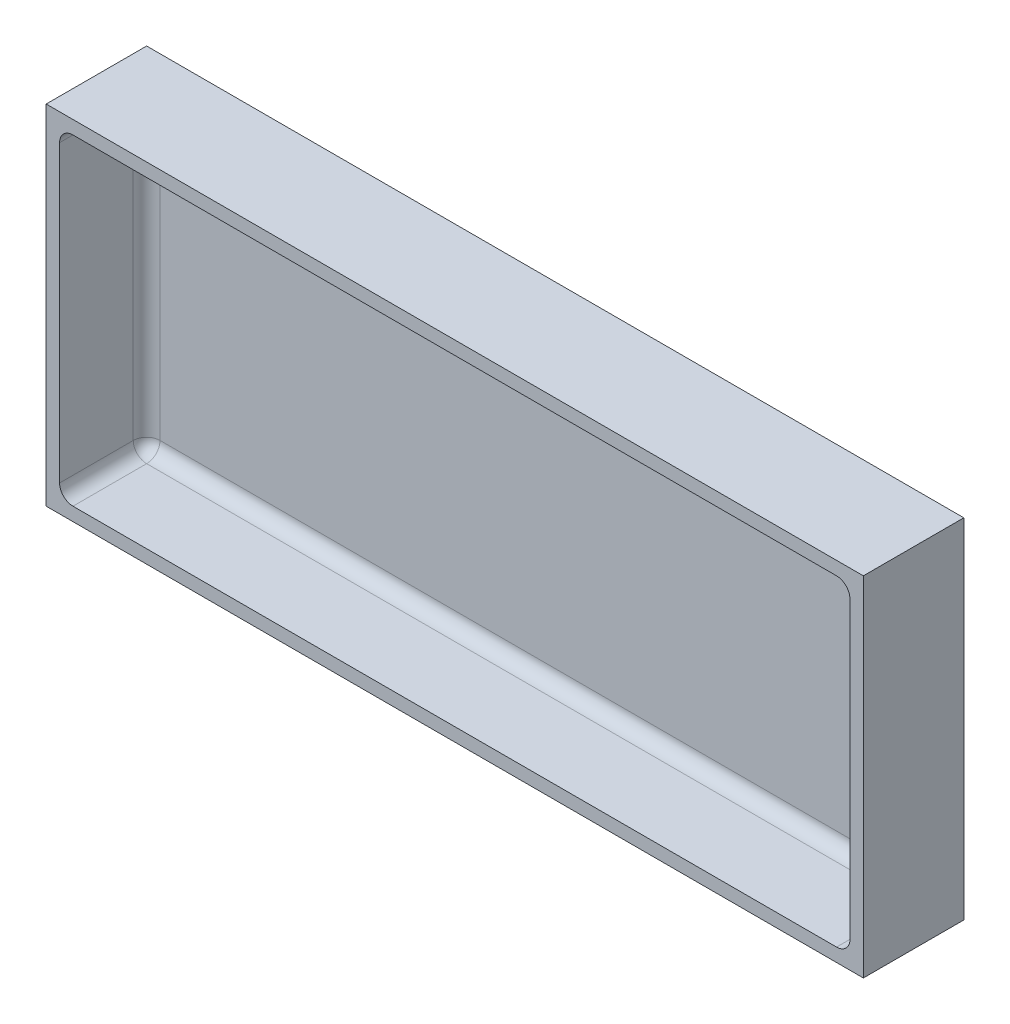
from build123d import *

# Parameters (mm, degrees)
SKETCH1_W           = 122
SKETCH1_H           = 52
BOSS_EXTRUDE1_DEPTH = 15
SHELL1_T            = -2
FILLET1_R           = 2


with BuildPart() as part:
    # Sketch1 → Boss-Extrude1 (new body)
    with BuildSketch(Plane.XY):
        Rectangle(SKETCH1_W, SKETCH1_H)
    extrude(amount=-BOSS_EXTRUDE1_DEPTH)

    # Shell1
    shell1_openings = [part.faces().sort_by_distance(p)[0] for p in [
        (0, 0, 0),
    ]]
    offset(amount=SHELL1_T, openings=shell1_openings, kind=Kind.INTERSECTION)

    # Fillet1
    fillet1_edges = [part.edges().sort_by_distance(p)[0] for p in [
        (-59, 24, -6.5),
        (-59, -24, -6.5),
        (0, -24, -13),
        (-59, 0, -13),
        (0, 24, -13),
        (59, 0, -13),
        (59, 24, -6.5),
        (59, -24, -6.5),
    ]]
    fillet(fillet1_edges, radius=FILLET1_R)


solid = part.part
